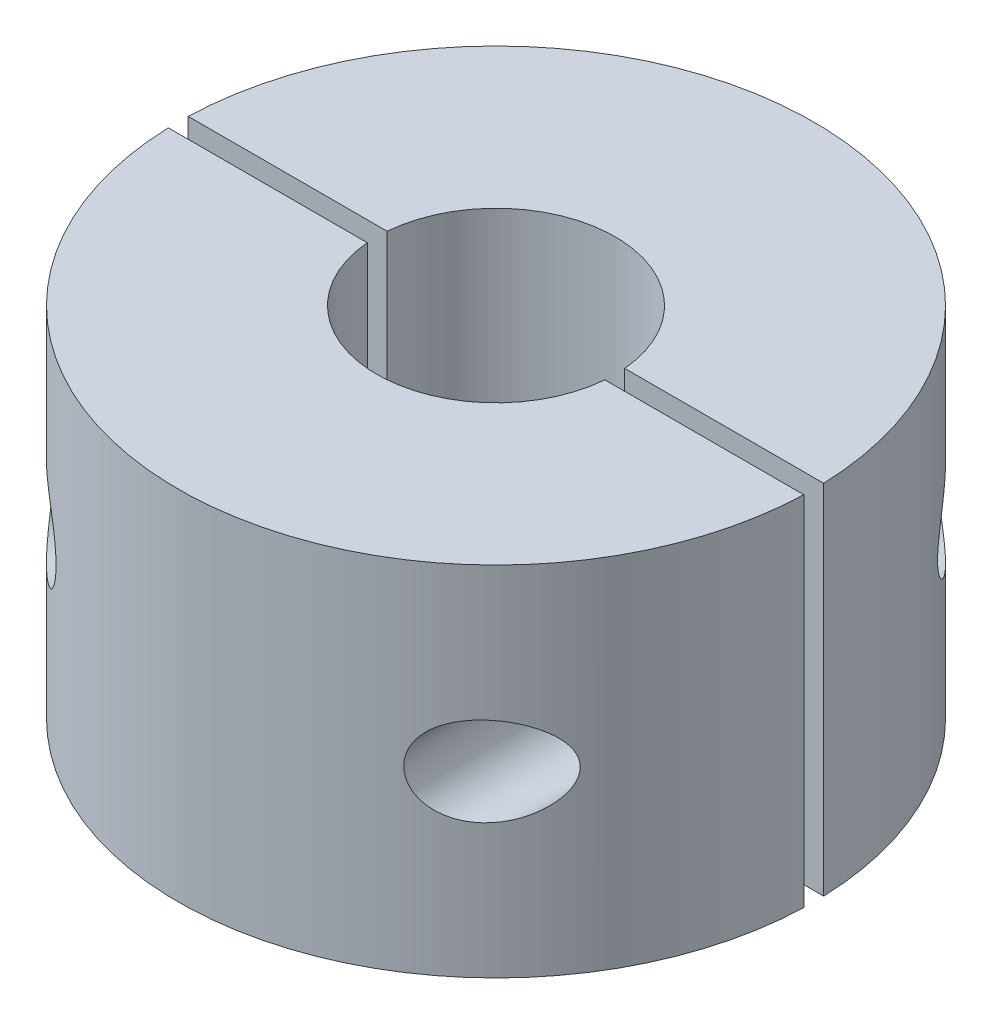
from build123d import *

# Parameters (mm, degrees)
SKETCH_1_R               = 8
EXTRUDE_1_DEPTH          = 9
SKETCH_3_R               = 3
CUT_EXTRUDE_2_DEPTH      = 15.456832295
SKETCH_5_W               = 20
SKETCH_5_H               = 0.5
CUT_EXTRUDE_4_DEPTH      = 15.456832295
CUT_EXTRUDE_5_DEPTH      = 15.454670525
CUT_EXTRUDE_5_DEPTH_BACK = 15.454670525
SKETCH_6_R               = 1.12021095


with BuildPart() as part:
    # 草图1 → 凸台-拉伸1 (new body)
    with BuildSketch(Plane(origin=(0, 0, 0), x_dir=(1, 0, 0), z_dir=(0, 1, 0))):
        Circle(SKETCH_1_R)
    extrude(amount=EXTRUDE_1_DEPTH)

    # 草图3 → 切除-拉伸2 (cut, through all)
    with BuildSketch(Plane(origin=(0, 9, 0), x_dir=(1, 0, 0), z_dir=(0, 1, 0))):
        Circle(SKETCH_3_R)
    extrude(amount=-CUT_EXTRUDE_2_DEPTH, mode=Mode.SUBTRACT)

    # 草图5 → 切除-拉伸4 (cut, through all)
    with BuildSketch(Plane(origin=(0, 9, 0), x_dir=(1, 0, 0), z_dir=(0, 1, 0))):
        Rectangle(SKETCH_5_W, SKETCH_5_H)
    extrude(amount=-CUT_EXTRUDE_4_DEPTH, mode=Mode.SUBTRACT)


with BuildPart() as cut_extrude_4_piece_1:
    # of the separate pieces the step leaves, piece 1, a body of its own (cut_extrude_4_pieces)
    add(part.part.solids().sort_by_distance((7.996092796, 0, -0.25))[0])


with BuildPart() as cut_extrude_4_piece_2:
    # of the separate pieces the step leaves, piece 2, a body of its own (cut_extrude_4_pieces)
    add(part.part.solids().sort_by_distance((-7.996092796, 0, 0.25))[0])


with BuildPart() as cut_extrude_5_tool:
    # 草图6 → 切除-拉伸5 (new, two sides: drawn at the far end of the back side and taken through both)
    with BuildSketch(Plane.XY.offset(-CUT_EXTRUDE_5_DEPTH_BACK)):
        with Locations((5.496092796, 4.5)):
            Circle(SKETCH_6_R)
        with Locations((-5.496092796, 4.5)):
            Circle(SKETCH_6_R)
    extrude(amount=CUT_EXTRUDE_5_DEPTH + CUT_EXTRUDE_5_DEPTH_BACK)


with BuildPart() as cut_extrude_4_piece_1_1:
    add(cut_extrude_4_piece_1.part)

    # 切除-拉伸5: cut by cut_extrude_5_tool
    add(cut_extrude_5_tool.part, mode=Mode.SUBTRACT)


with BuildPart() as cut_extrude_4_piece_2_1:
    add(cut_extrude_4_piece_2.part)

    # 切除-拉伸5: cut by cut_extrude_5_tool
    add(cut_extrude_5_tool.part, mode=Mode.SUBTRACT)


solid = Compound([cut_extrude_4_piece_1_1.part, cut_extrude_4_piece_2_1.part])
